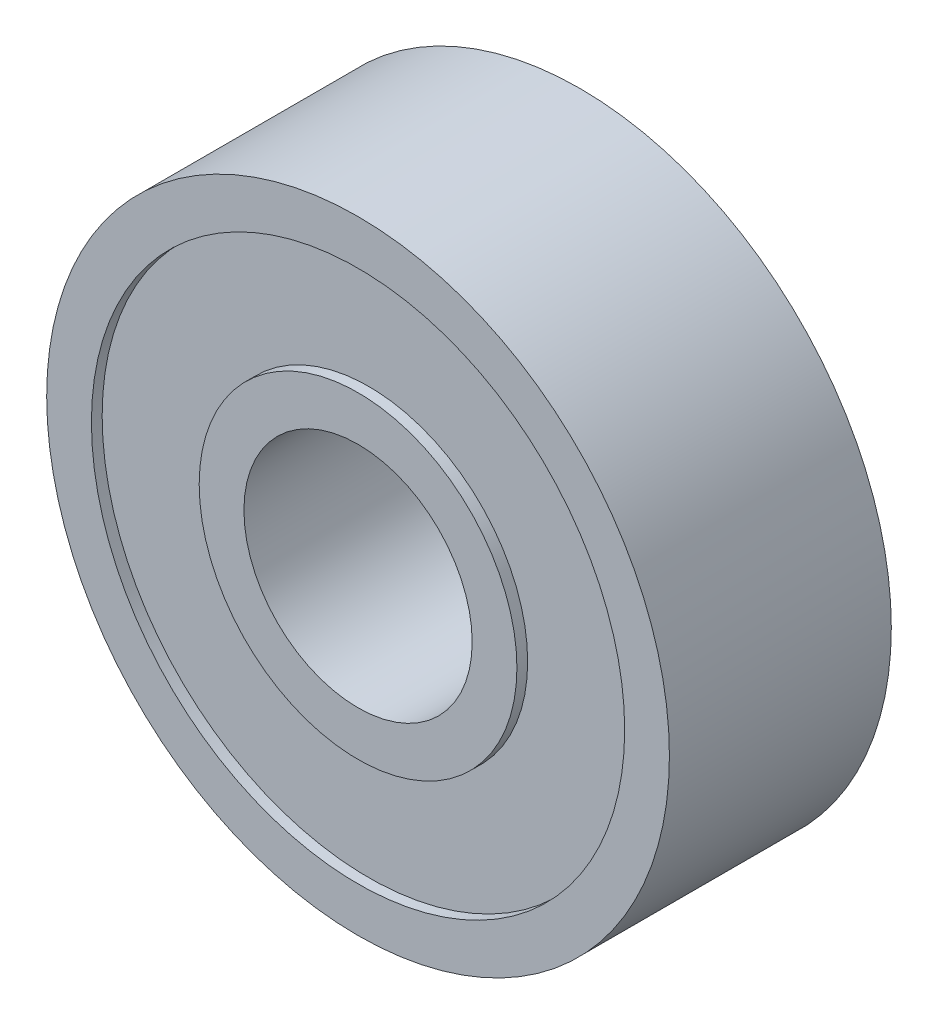
from build123d import *

# Parameters (mm, degrees)
SKETCH1_R           = 11.049
SKETCH1_R_2         = 4.05
BOSS_EXTRUDE1_DEPTH = 3.937
SKETCH2_R           = 9.4615
SKETCH2_R_2         = 5.6375
CUT_EXTRUDE1_DEPTH  = 0.381


with BuildPart() as part:
    # Sketch1 → Boss-Extrude1 (new, symmetric)
    with BuildSketch(Plane.XY):
        Circle(SKETCH1_R)
        Circle(SKETCH1_R_2, mode=Mode.SUBTRACT)
    extrude(amount=BOSS_EXTRUDE1_DEPTH, both=True)

    # Sketch2 → Cut-Extrude1 (cut)
    with BuildSketch(Plane.XY.offset(3.937)):
        Circle(SKETCH2_R)
        Circle(SKETCH2_R_2, mode=Mode.SUBTRACT)
    cut_extrude1 = extrude(amount=-CUT_EXTRUDE1_DEPTH, mode=Mode.SUBTRACT)

    # Mirror1: Cut-Extrude1 across plane
    add(cut_extrude1.mirror(Plane.XY), mode=Mode.SUBTRACT)


solid = part.part
